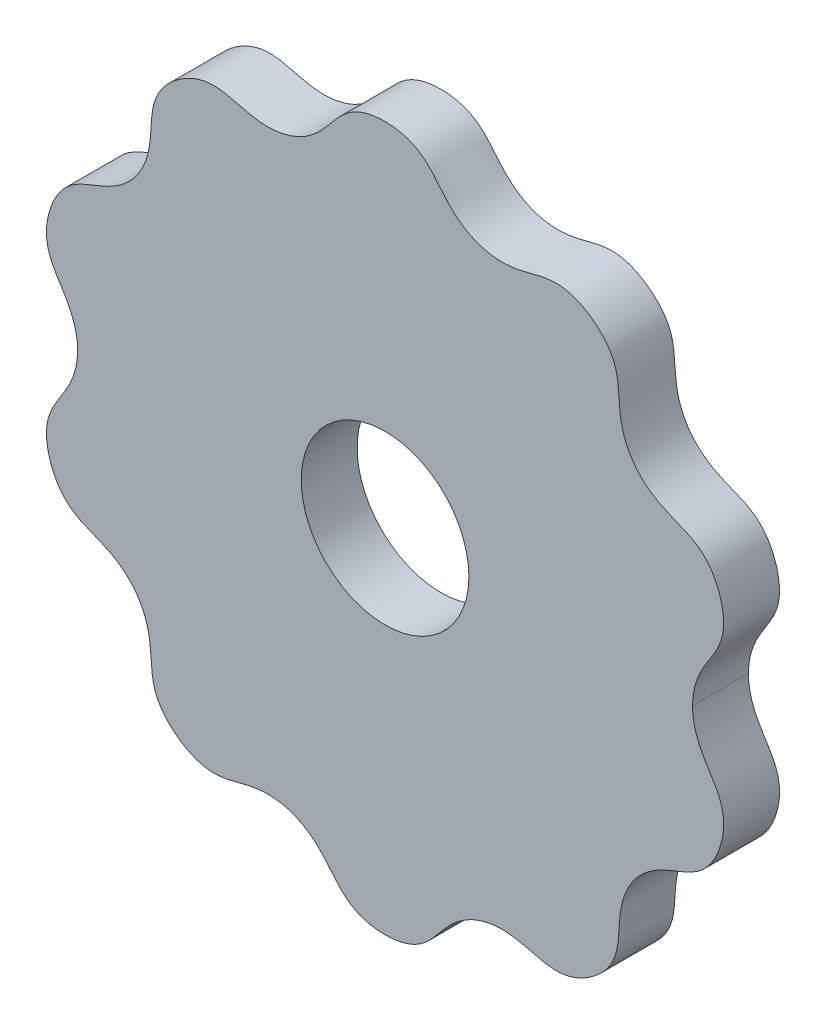
from build123d import *

# Parameters (mm, degrees)
SKETCH1_R           = 7.5
BOSS_EXTRUDE1_DEPTH = 5


with BuildPart() as part:
    # Sketch1 → Boss-Extrude1 (new body)
    with BuildSketch(Plane.XY.offset(4)):
        with BuildLine():
            add(Edge.make_bspline(
                [(-25.5, 0), (-25.499999944, -0.55264167), (-25.574624638, -1.243443685), (-25.843271605, -2.325766828), (-26.42386399, -3.450382485), (-27.218671239, -4.615329397), (-27.79419934, -5.55762117), (-28.265802381, -6.810852247), (-28.386368212, -8.032308786), (-28.131426633, -9.476817107), (-27.580553031, -10.855205434), (-26.854940575, -11.87685831), (-25.95585092, -12.682738421), (-24.998193101, -13.188228528), (-23.691191057, -13.675501919), (-22.370945757, -14.191020551), (-20.887153986, -15.23851429), (-19.911020326, -16.444919988), (-19.179886985, -18.108438373), (-18.967304918, -19.498546212), (-18.925579032, -20.908183963), (-18.837325838, -22.008800951), (-18.482229969, -23.299887503), (-17.861815635, -24.358933418), (-16.806502877, -25.377714298), (-15.55064044, -26.1690585), (-14.363095139, -26.569088738), (-13.162031884, -26.692587804), (-12.090150804, -26.538640748), (-10.746351825, -26.164616676), (-9.375236692, -25.805659294), (-7.559122561, -25.780948609), (-6.060306364, -26.183194351), (-4.491015492, -27.0992596), (-3.5019481, -28.098927862), (-2.639626868, -29.214822898), (-1.921302101, -30.05336682), (-0.875141873, -30.889157666), (0.249275437, -31.381273414), (1.701865769, -31.585187183), (3.183020274, -31.487220672), (4.378896479, -31.112830319), (5.423167994, -30.506775893), (6.199850194, -29.752194218), (7.067160571, -28.659737165), (7.96542616, -27.563413288), (9.420168779, -26.475936823), (10.86917067, -25.920378407), (12.677203298, -25.73908473), (14.064965888, -25.966474117), (15.418505064, -26.362392461), (16.492525759, -26.61856804), (17.830152695, -26.679819485), (19.029083787, -26.417033576), (20.324111558, -25.728192106), (21.464807453, -24.778334759), (22.212230498, -23.772528204), (22.700834046, -22.668412478), (22.885651166, -21.601420736), (22.945189856, -20.207812167), (23.027498976, -18.792880253), (23.565207848, -17.058017054), (24.410925959, -15.756858912), (25.767093332, -14.547454332), (27.023472979, -13.915709826), (28.35122414, -13.440424129), (29.370701361, -13.016381001), (30.488866981, -12.279697075), (31.304360927, -11.362384794), (31.947169545, -10.043902113), (32.31169977, -8.604967152), (32.325179455, -7.351928313), (32.071485089, -6.171485968), (31.593843269, -5.199638738), (30.822868516, -4.037189758), (30.057781881, -2.844105707), (29.652980933, -1.653619947), (29.518656276, -0.828962522), (29.500000014, -0.138160417), (29.5, 0)],
                knots=[0.5, 0.5, 0.5, 0.5, 0.5, 0.5, 0.513333333, 0.516666667, 0.526666667, 0.53, 0.533333333, 0.54, 0.55, 0.556666667, 0.563333333, 0.566666667, 0.57, 0.58, 0.583333333, 0.596666667, 0.6, 0.613333333, 0.616666667, 0.626666667, 0.63, 0.633333333, 0.64, 0.65, 0.656666667, 0.663333333, 0.666666667, 0.67, 0.68, 0.683333333, 0.696666667, 0.7, 0.713333333, 0.716666667, 0.726666667, 0.73, 0.733333333, 0.74, 0.75, 0.756666667, 0.763333333, 0.766666667, 0.77, 0.78, 0.783333333, 0.796666667, 0.8, 0.813333333, 0.816666667, 0.826666667, 0.83, 0.833333333, 0.84, 0.85, 0.856666667, 0.863333333, 0.866666667, 0.87, 0.88, 0.883333333, 0.896666667, 0.9, 0.913333333, 0.916666667, 0.926666667, 0.93, 0.933333333, 0.94, 0.95, 0.956666667, 0.963333333, 0.966666667, 0.97, 0.98, 0.983333333, 0.996666667, 1, 1, 1, 1, 1, 1], degree=5, weights=[1, 1, 1, 1, 1, 1, 1, 1, 1, 1, 1, 1, 1, 1, 1, 1, 1, 1, 1, 1, 1, 1, 1, 1, 1, 1, 1, 1, 1, 1, 1, 1, 1, 1, 1, 1, 1, 1, 1, 1, 1, 1, 1, 1, 1, 1, 1, 1, 1, 1, 1, 1, 1, 1, 1, 1, 1, 1, 1, 1, 1, 1, 1, 1, 1, 1, 1, 1, 1, 1, 1, 1, 1, 1, 1, 1, 1, 1, 1, 1]))
            add(Edge.make_bspline(
                [(29.5, 0), (29.499999944, 0.55264167), (29.574624638, 1.243443685), (29.843271605, 2.325766828), (30.42386399, 3.450382485), (31.218671239, 4.615329397), (31.79419934, 5.55762117), (32.265802381, 6.810852247), (32.386368212, 8.032308786), (32.131426633, 9.476817107), (31.580553031, 10.855205434), (30.854940575, 11.87685831), (29.95585092, 12.682738421), (28.998193101, 13.188228528), (27.691191057, 13.675501919), (26.370945757, 14.191020551), (24.887153986, 15.23851429), (23.911020326, 16.444919988), (23.179886985, 18.108438373), (22.967304918, 19.498546212), (22.925579032, 20.908183963), (22.837325838, 22.008800951), (22.482229969, 23.299887503), (21.861815635, 24.358933418), (20.806502877, 25.377714298), (19.55064044, 26.1690585), (18.363095139, 26.569088738), (17.162031884, 26.692587804), (16.090150804, 26.538640748), (14.746351825, 26.164616676), (13.375236692, 25.805659294), (11.559122561, 25.780948609), (10.060306364, 26.183194351), (8.491015492, 27.0992596), (7.5019481, 28.098927862), (6.639626868, 29.214822898), (5.921302101, 30.05336682), (4.875141873, 30.889157666), (3.750724563, 31.381273414), (2.298134231, 31.585187183), (0.816979726, 31.487220672), (-0.378896479, 31.112830319), (-1.423167994, 30.506775893), (-2.199850194, 29.752194218), (-3.067160571, 28.659737165), (-3.96542616, 27.563413288), (-5.420168779, 26.475936823), (-6.86917067, 25.920378407), (-8.677203298, 25.73908473), (-10.064965888, 25.966474117), (-11.418505064, 26.362392461), (-12.492525759, 26.61856804), (-13.830152695, 26.679819485), (-15.029083787, 26.417033576), (-16.324111558, 25.728192106), (-17.464807453, 24.778334759), (-18.212230498, 23.772528204), (-18.700834046, 22.668412478), (-18.885651166, 21.601420736), (-18.945189856, 20.207812167), (-19.027498976, 18.792880253), (-19.565207848, 17.058017054), (-20.410925959, 15.756858912), (-21.767093332, 14.547454332), (-23.023472979, 13.915709826), (-24.35122414, 13.440424129), (-25.370701361, 13.016381001), (-26.488866981, 12.279697075), (-27.304360927, 11.362384794), (-27.947169545, 10.043902113), (-28.31169977, 8.604967152), (-28.325179455, 7.351928313), (-28.071485089, 6.171485968), (-27.593843269, 5.199638738), (-26.822868516, 4.037189758), (-26.057781881, 2.844105707), (-25.652980934, 1.653619947), (-25.518656276, 0.828962522), (-25.500000014, 0.138160417), (-25.5, 0)],
                knots=[0, 0, 0, 0, 0, 0, 0.013333333, 0.016666667, 0.026666667, 0.03, 0.033333333, 0.04, 0.05, 0.056666667, 0.063333333, 0.066666667, 0.07, 0.08, 0.083333333, 0.096666667, 0.1, 0.113333333, 0.116666667, 0.126666667, 0.13, 0.133333333, 0.14, 0.15, 0.156666667, 0.163333333, 0.166666667, 0.17, 0.18, 0.183333333, 0.196666667, 0.2, 0.213333333, 0.216666667, 0.226666667, 0.23, 0.233333333, 0.24, 0.25, 0.256666667, 0.263333333, 0.266666667, 0.27, 0.28, 0.283333333, 0.296666667, 0.3, 0.313333333, 0.316666667, 0.326666667, 0.33, 0.333333333, 0.34, 0.35, 0.356666667, 0.363333333, 0.366666667, 0.37, 0.38, 0.383333333, 0.396666667, 0.4, 0.413333333, 0.416666667, 0.426666667, 0.43, 0.433333333, 0.44, 0.45, 0.456666667, 0.463333333, 0.466666667, 0.47, 0.48, 0.483333333, 0.496666667, 0.5, 0.5, 0.5, 0.5, 0.5, 0.5], degree=5, weights=[1, 1, 1, 1, 1, 1, 1, 1, 1, 1, 1, 1, 1, 1, 1, 1, 1, 1, 1, 1, 1, 1, 1, 1, 1, 1, 1, 1, 1, 1, 1, 1, 1, 1, 1, 1, 1, 1, 1, 1, 1, 1, 1, 1, 1, 1, 1, 1, 1, 1, 1, 1, 1, 1, 1, 1, 1, 1, 1, 1, 1, 1, 1, 1, 1, 1, 1, 1, 1, 1, 1, 1, 1, 1, 1, 1, 1, 1, 1, 1]))
        make_face()
        with Locations((2, 0)):
            Circle(SKETCH1_R, mode=Mode.SUBTRACT)
    extrude(amount=BOSS_EXTRUDE1_DEPTH)


solid = part.part
